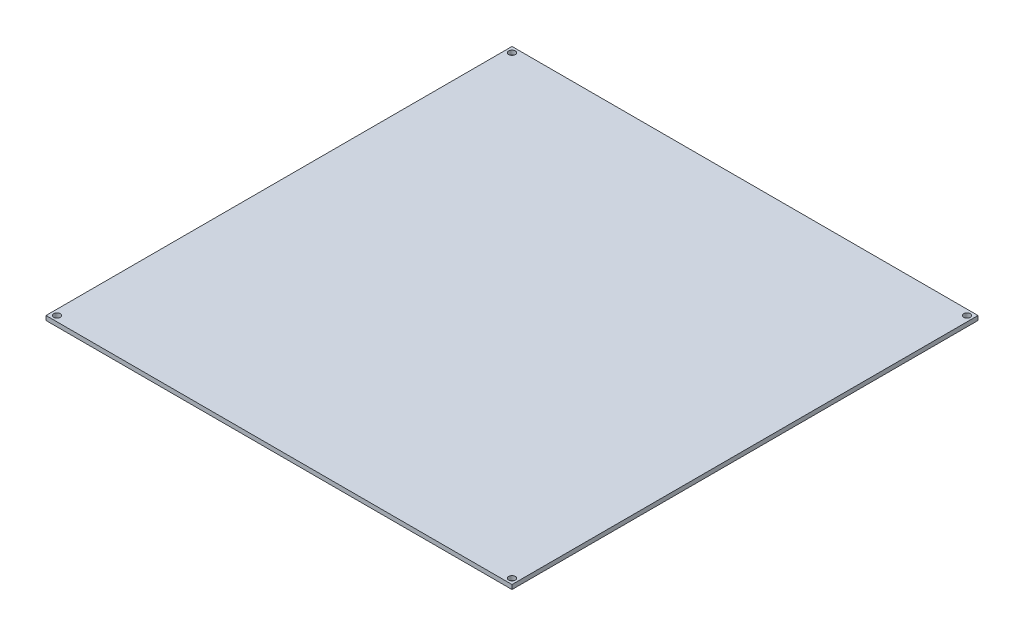
from build123d import *

# Parameters (mm, degrees)
SKICA1_W                = 214
SKICA1_H                = 214
SKICA1_R                = 1.5
P_IDAT_VYSUNUT_M1_DEPTH = 2


with BuildPart() as part:
    # Skica1 → Přidat vysunutím1 (new body)
    with BuildSketch(Plane(origin=(0, 0, 0), x_dir=(1, 0, 0), z_dir=(0, 1, 0))):
        Rectangle(SKICA1_W, SKICA1_H)
        with Locations((104.5, 104.5)):
            Circle(SKICA1_R, mode=Mode.SUBTRACT)
        with Locations((-104.5, 104.5)):
            Circle(SKICA1_R, mode=Mode.SUBTRACT)
        with Locations((-104.5, -104.5)):
            Circle(SKICA1_R, mode=Mode.SUBTRACT)
        with Locations((104.5, -104.5)):
            Circle(SKICA1_R, mode=Mode.SUBTRACT)
    extrude(amount=P_IDAT_VYSUNUT_M1_DEPTH)


solid = part.part
